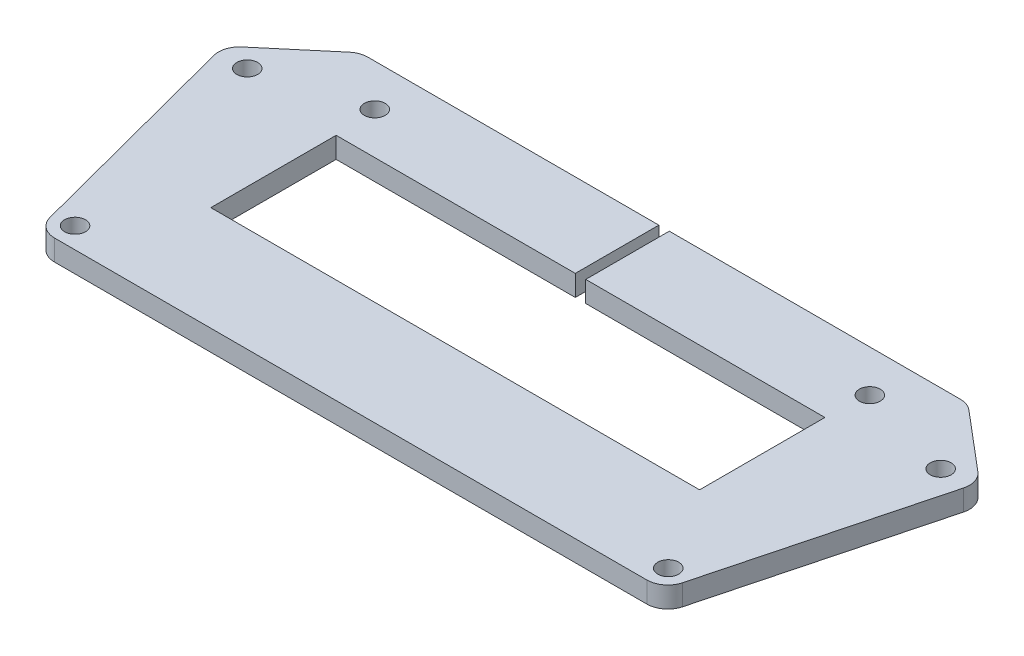
from build123d import *

# Parameters (mm, degrees)
SKETCH1_R          = 0.5
BASE_FLANGE1_DEPTH = 1


# Sheet-metal steps are written as plain solids
with BuildPart() as part:
    # Sketch1 → Base-Flange1 (new body)
    with BuildSketch(Plane(origin=(0, 0, 0), x_dir=(1, 0, 0), z_dir=(0, 1, 0))):
        with BuildLine():
            Line((-14.178620776, -8), (14.178620776, -8))
            ThreePointArc((14.178620776, -8), (14.789399734, -7.791801152), (15.145851741, -7.253898128))
            Line((15.145851741, -7.253898128), (17.939776994, 3.389626646))
            ThreePointArc((17.939776994, 3.389626646), (17.926022481, 3.944992277), (17.618005902, 4.407318956))
            Line((17.618005902, 4.407318956), (14.829510217, 6.763794182))
            ThreePointArc((14.829510217, 6.763794182), (14.527711383, 6.939093761), (14.184050345, 7))
            Line((14.184050345, 7), (0.25, 7))
            Line((0.25, 7), (0.25, 3))
            Line((0.25, 3), (11.7, 3))
            Line((11.7, 3), (11.7, -3))
            Line((11.7, -3), (-11.7, -3))
            Line((-11.7, -3), (-11.7, 3))
            Line((-11.7, 3), (-0.25, 3))
            Line((-0.25, 3), (-0.25, 7))
            Line((-0.25, 7), (-14.184050345, 7))
            ThreePointArc((-14.184050345, 7), (-14.527711383, 6.939093761), (-14.829510217, 6.763794182))
            Line((-14.829510217, 6.763794182), (-17.618005902, 4.407318956))
            ThreePointArc((-17.618005902, 4.407318956), (-17.926022481, 3.944992277), (-17.939776994, 3.389626646))
            Line((-17.939776994, 3.389626646), (-15.145851741, -7.253898128))
            ThreePointArc((-15.145851741, -7.253898128), (-14.789399734, -7.791801152), (-14.178620776, -8))
        make_face()
        with Locations(Location((-14.2, -7, 0), (0, 0, 270))):
            Circle(SKETCH1_R, mode=Mode.SUBTRACT)
        with Locations(Location((14.2, -7, 0), (0, 0, 270))):
            Circle(SKETCH1_R, mode=Mode.SUBTRACT)
        with Locations(Location((-16.6, 3.643524774, 0), (0, 0, 270))):
            Circle(SKETCH1_R, mode=Mode.SUBTRACT)
        with Locations(Location((16.6, 3.643524774, 0), (0, 0, 270))):
            Circle(SKETCH1_R, mode=Mode.SUBTRACT)
        with Locations(Location((-11.85, 5, 0), (0, 0, 270))):
            Circle(SKETCH1_R, mode=Mode.SUBTRACT)
        with Locations(Location((11.85, 5, 0), (0, 0, 270))):
            Circle(SKETCH1_R, mode=Mode.SUBTRACT)
    extrude(amount=-BASE_FLANGE1_DEPTH)


solid = part.part
